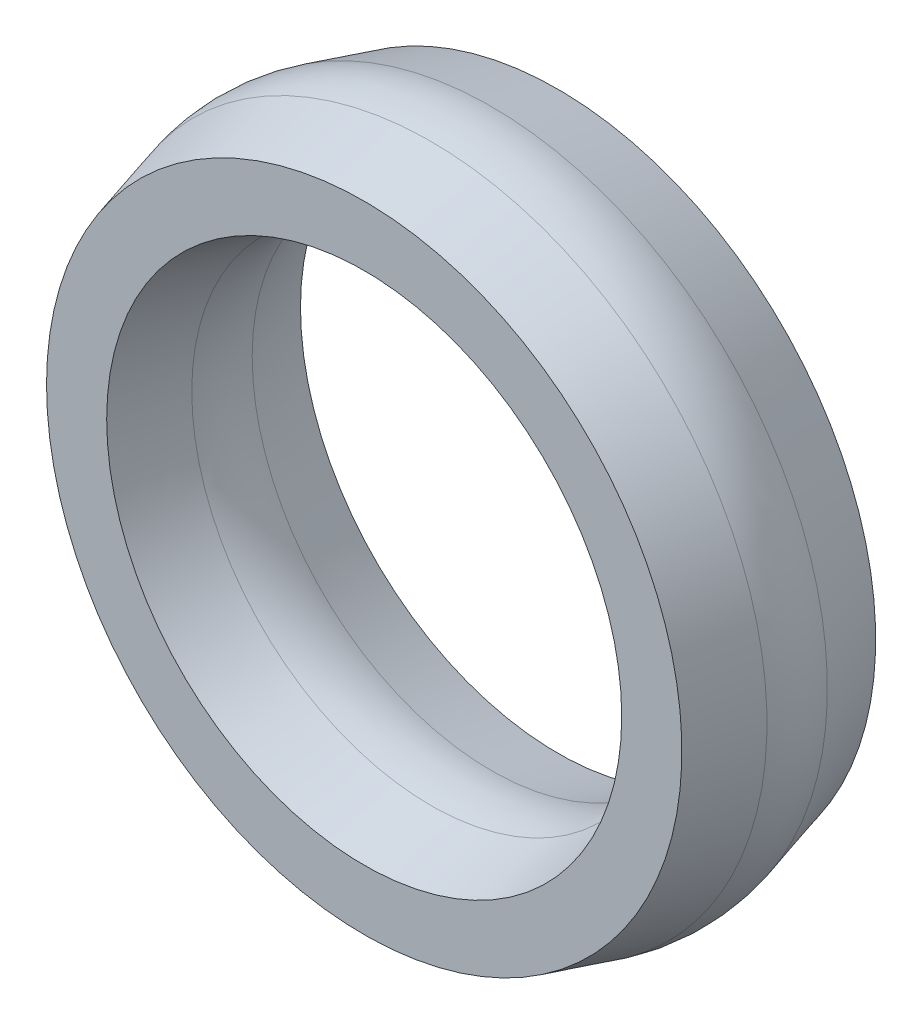
from build123d import *


with BuildPart() as part:
    # Sketch1 → Body (revolve)
    with BuildSketch(Plane(origin=(0, 0, 0), x_dir=(-1, 0, 0), z_dir=(0, 1, 0))):
        with BuildLine():
            Line((-23.767494906, 0), (-19.267494906, 0))
            Line((-19.267494906, 0), (-17.891052556, -4.989603516))
            ThreePointArc((-17.891052556, -4.989603516), (-17.584989811, -7.25), (-17.891052556, -9.510396484))
            Line((-17.891052556, -9.510396484), (-19.267494906, -14.5))
            Line((-19.267494906, -14.5), (-23.767494906, -14.5))
            Line((-23.767494906, -14.5), (-25.143937255, -9.510396484))
            ThreePointArc((-25.143937255, -9.510396484), (-25.45, -7.25), (-25.143937255, -4.989603516))
            Line((-25.143937255, -4.989603516), (-23.767494906, 0))
        make_face()
    revolve(axis=Axis((0, 0, -7.25), (0, 0, 1)))


solid = part.part
